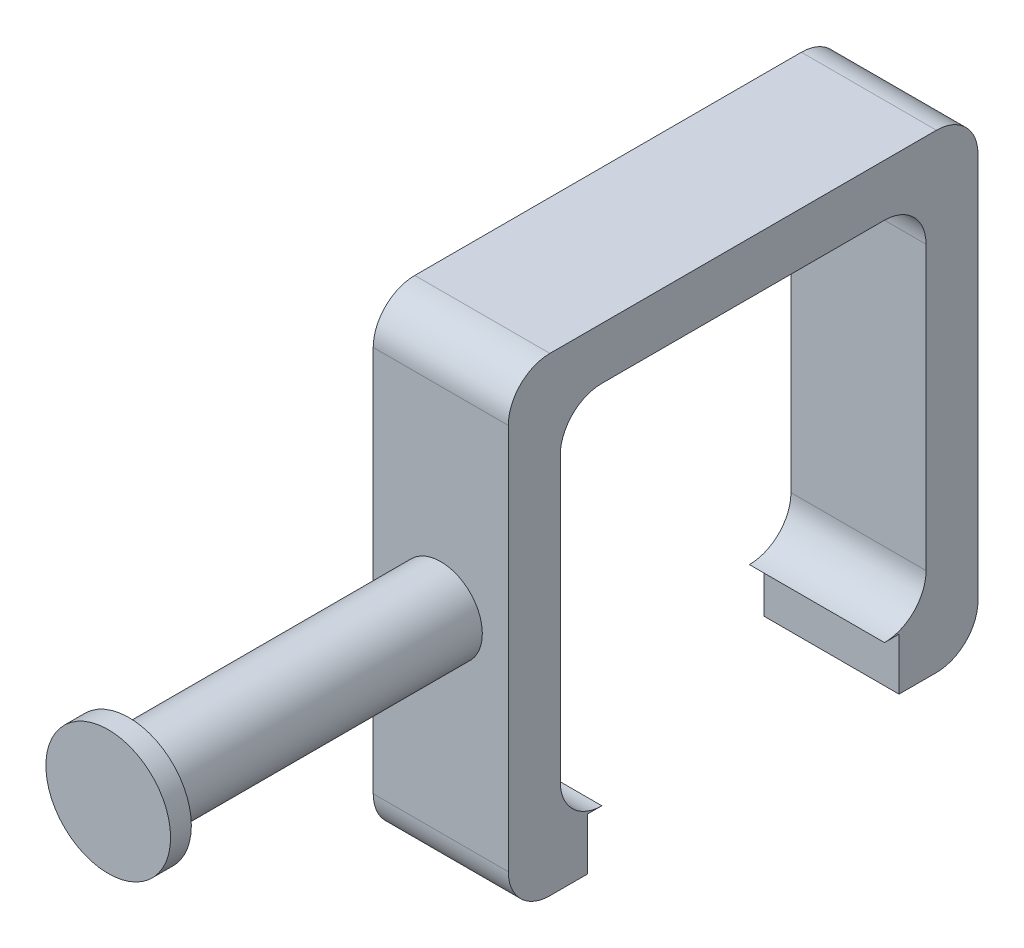
from build123d import *

# Parameters (mm, degrees)
SKETCH1_W           = 45.2
SKETCH1_H           = 45.2
SKETCH1_W_2         = 35.2
SKETCH1_H_2         = 35.2
BOSS_EXTRUDE1_DEPTH = 13
FILLET1_R           = 4
SKETCH3_W           = 30
SKETCH3_H           = 5
CUT_EXTRUDE1_DEPTH  = 35.503912822
SKETCH4_R           = 4
BOSS_EXTRUDE2_DEPTH = 30
SKETCH5_R           = 6
BOSS_EXTRUDE3_DEPTH = 2


with BuildPart() as part:
    # Sketch1 → Boss-Extrude1 (new body)
    with BuildSketch(Plane(origin=(0, 0, 0), x_dir=(0, 0, -1), z_dir=(1, 0, 0))):
        Rectangle(SKETCH1_W, SKETCH1_H)
        Rectangle(SKETCH1_W_2, SKETCH1_H_2, mode=Mode.SUBTRACT)
    extrude(amount=-BOSS_EXTRUDE1_DEPTH)

    # Fillet1
    fillet1_edges = [part.edges().sort_by_distance(p)[0] for p in [
        (-6.5, -22.6, -22.6),
        (-6.5, -22.6, 22.6),
        (-6.5, 22.6, 22.6),
        (-6.5, 22.6, -22.6),
        (-6.5, -17.6, -17.6),
        (-6.5, 17.6, -17.6),
        (-6.5, -17.6, 17.6),
        (-6.5, 17.6, 17.6),
    ]]
    fillet(fillet1_edges, radius=FILLET1_R)

    # Sketch3 → Cut-Extrude1 (cut, through all)
    with BuildSketch(Plane(origin=(0, 0, 0), x_dir=(0, 0, -1), z_dir=(1, 0, 0))):
        with Locations((0, -20.1)):
            Rectangle(SKETCH3_W, SKETCH3_H)
    extrude(amount=-CUT_EXTRUDE1_DEPTH, mode=Mode.SUBTRACT)

    # Sketch4 → Boss-Extrude2 (add)
    with BuildSketch(Plane.XY.offset(22.6)):
        with Locations((-6.5, 0)):
            Circle(SKETCH4_R)
    extrude(amount=BOSS_EXTRUDE2_DEPTH)

    # Sketch5 → Boss-Extrude3 (add)
    with BuildSketch(Plane.XY.offset(52.6)):
        with Locations((-6.5, 0)):
            Circle(SKETCH5_R)
    extrude(amount=BOSS_EXTRUDE3_DEPTH)


solid = part.part
